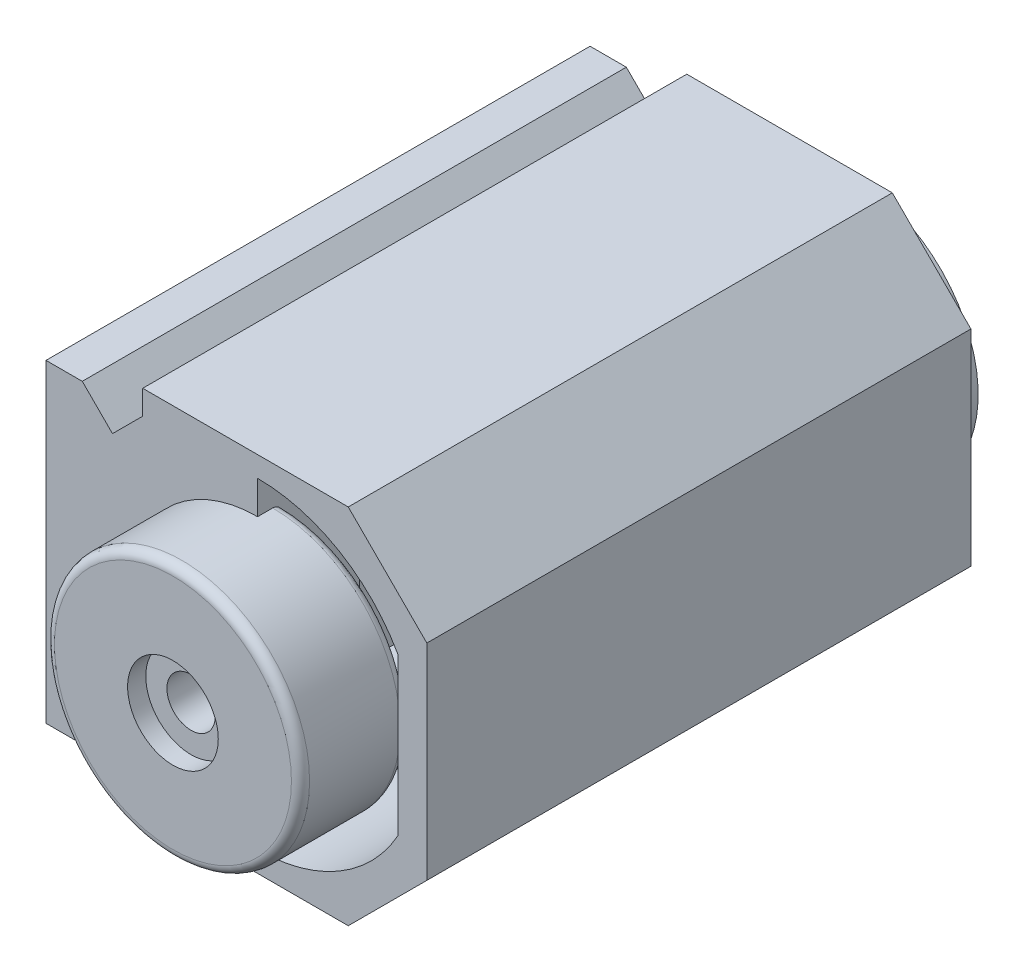
from build123d import *

# Parameters (mm, degrees)
BOSS_EXTRUDE1_DEPTH = 22.5
SKETCH2_R           = 10.5
SKETCH2_R_2         = 2
SKETCH2_R_3         = 0.5
BOSS_EXTRUDE2_DEPTH = 4.1
BOSS_EXTRUDE3_START = 7
SKETCH4_R           = 10.55
SKETCH4_R_2         = 2
BOSS_EXTRUDE3_DEPTH = 7
SKETCH5_R           = 3.75
CUT_EXTRUDE1_DEPTH  = 1.5
CUT_EXTRUDE2_DEPTH  = 15
SKETCH8_W           = 33
SKETCH8_H           = 13
CUT_EXTRUDE4_DEPTH  = 11.75
SKETCH9_W           = 22.9
SKETCH9_H           = 13
CUT_EXTRUDE5_DEPTH  = 17
SKETCH10_R          = 0.75
CUT_EXTRUDE6_DEPTH  = 8
SKETCH11_R          = 0.9
CUT_EXTRUDE7_DEPTH  = 10.75
CUT_EXTRUDE8_DEPTH  = 13
FILLET2_R           = 0.75
SKETCH14_W          = 13.5
SKETCH14_H          = 13
CUT_EXTRUDE9_DEPTH  = 7
FILLET3_R           = 6
SKETCH15_W          = 2
SKETCH15_H          = 20.442632008
CUT_EXTRUDE10_DEPTH = 54.926431367
SKETCH16_W          = 2.396552237
SKETCH16_H          = 13
BOSS_EXTRUDE5_DEPTH = 15
CHAMFER1_SIZE       = 0.35
CHAMFER1_SIZE_2     = 1
SKETCH17_W          = 0.25
SKETCH17_H          = 13
CUT_EXTRUDE11_DEPTH = 11.75


with BuildPart() as part:
    # Sketch1 → Boss-Extrude1 (new, symmetric)
    with BuildSketch(Plane.XY):
        Polygon((8.5, 15), (16, 7.5), (16, -7.5), (8.5, -15), (-8.5, -15), (-8.5, -13), (-11, -10.5), (-13.5, -13), (-16.5, -13), (-16.5, 13), (-13.5, 13), (-11, 10.5), (-8.5, 13), (-8.5, 15), align=None)
    extrude(amount=BOSS_EXTRUDE1_DEPTH, both=True)

    # Sketch2 → Boss-Extrude2 (add)
    with BuildSketch(Plane(origin=(0, 0, -22.5), x_dir=(-1, 0, 0), z_dir=(0, 0, -1))):
        with Locations((-1, 0)):
            Circle(SKETCH2_R)
        with Locations((-1, 0)):
            Circle(SKETCH2_R_2, mode=Mode.SUBTRACT)
        with Locations((-1, 6)):
            Circle(SKETCH2_R_3, mode=Mode.SUBTRACT)
        with Locations((-1, -6)):
            Circle(SKETCH2_R_3, mode=Mode.SUBTRACT)
    extrude(amount=BOSS_EXTRUDE2_DEPTH)

    # Sketch4 → Boss-Extrude3 (add)
    with BuildSketch(Plane.XY.offset(22.5).offset(BOSS_EXTRUDE3_START)):
        with Locations(Location((1, 0, 0), (0, 0, 180))):
            Circle(SKETCH4_R)
        with Locations(Location((1, 0, 0), (0, 0, 180))):
            Circle(SKETCH4_R_2, mode=Mode.SUBTRACT)
    extrude(amount=-BOSS_EXTRUDE3_DEPTH)

    # Sketch5 → Cut-Extrude1 (cut)
    with BuildSketch(Plane.XY.offset(29.5)):
        with Locations((1, 0)):
            Circle(SKETCH5_R)
    extrude(amount=-CUT_EXTRUDE1_DEPTH, mode=Mode.SUBTRACT)

    # Sketch6 → Cut-Extrude2 (cut)
    with BuildSketch(Plane.XY.offset(22.5)):
        with BuildLine():
            Line((1, 13.3), (1, 10.55))
            ThreePointArc((1, 10.55), (11.55, 0), (1, -10.55))
            Line((1, -10.55), (1, -13.3))
            ThreePointArc((1, -13.3), (14.3, 0), (1, 13.3))
        make_face()
    extrude(amount=-CUT_EXTRUDE2_DEPTH, mode=Mode.SUBTRACT)

    # Sketch8 → Cut-Extrude4 (cut)
    with BuildSketch(Plane.ZY.offset(16.5)):
        with Locations((-4.5, 0)):
            Rectangle(SKETCH8_W, SKETCH8_H)
    extrude(amount=-CUT_EXTRUDE4_DEPTH, mode=Mode.SUBTRACT)

    # Sketch9 → Cut-Extrude5 (cut)
    with BuildSketch(Plane.ZY.offset(4.75)):
        with Locations((-4.4, 0)):
            Rectangle(SKETCH9_W, SKETCH9_H)
    extrude(amount=-CUT_EXTRUDE5_DEPTH, mode=Mode.SUBTRACT)

    # Sketch10 → Cut-Extrude6 (cut)
    with BuildSketch(Plane.ZY.offset(16.5)):
        with Locations((0, 9)):
            Circle(SKETCH10_R)
        with Locations((0, -9)):
            Circle(SKETCH10_R)
    extrude(amount=-CUT_EXTRUDE6_DEPTH, mode=Mode.SUBTRACT)

    # Sketch11 → Cut-Extrude7 (cut)
    with BuildSketch(Plane.ZY.offset(4.75)):
        with Locations((-19.05, 0)):
            Circle(SKETCH11_R)
        with Locations((8.75, 0)):
            Circle(SKETCH11_R)
    extrude(amount=-CUT_EXTRUDE7_DEPTH, mode=Mode.SUBTRACT)

    # Sketch12 → Cut-Extrude8 (cut)
    with BuildSketch(Plane.XY.offset(20.5)):
        with BuildLine():
            Line((1, 13.3), (1, -13.3))
            ThreePointArc((1, -13.3), (14.3, 0), (1, 13.3))
        make_face()
    extrude(amount=-CUT_EXTRUDE8_DEPTH, mode=Mode.SUBTRACT)

    # Fillet2
    fillet2_edges = [part.edges().sort_by_distance(p)[0] for p in [
        (11.55, 0, 20.5),
        (11.55, 0, 29.5),
    ]]
    fillet(fillet2_edges, radius=FILLET2_R)

    # Sketch14 → Cut-Extrude9 (cut)
    with BuildSketch(Plane(origin=(0, 0, 7.05), x_dir=(-1, 0, 0), z_dir=(0, 0, -1))):
        with Locations((-5.5, 0)):
            Rectangle(SKETCH14_W, SKETCH14_H)
    extrude(amount=-CUT_EXTRUDE9_DEPTH, mode=Mode.SUBTRACT)

    # Fillet3
    # the kernel refuses this fillet: 6 mm, written as the material it takes off along each edge
    with BuildSketch(Plane(origin=(1, 6.5, 7.5), x_dir=(0, 0, -1), z_dir=(1, 0, 0))) as fillet3_piece_1_section:
        with BuildLine():
            CenterArc((FILLET3_R, FILLET3_R), FILLET3_R, 180, 90)
            Line((0, FILLET3_R), (0, 0))
            Line((0, 0), (FILLET3_R, 0))
        make_face()
    fillet3_piece_1 = extrude(amount=8.309783391, mode=Mode.PRIVATE)
    fillet3_piece_1 = fillet3_piece_1 & Plane(origin=(1, 0, 5.762056744), x_dir=(0, -1, 0), z_dir=(0, 0, 1)) * Cylinder(13.3, 41, mode=Mode.PRIVATE)
    add(fillet3_piece_1, mode=Mode.SUBTRACT)
    with BuildSketch(Plane(origin=(9.309783391, -6.5, 7.5), x_dir=(0, -1, 0), z_dir=(-1, 0, 0))) as fillet3_piece_2_section:
        with BuildLine():
            CenterArc((FILLET3_R, -FILLET3_R), FILLET3_R, 90, 90)
            Line((0, -FILLET3_R), (0, 0))
            Line((0, 0), (FILLET3_R, 0))
        make_face()
    fillet3_piece_2 = extrude(amount=8.309783391, mode=Mode.PRIVATE)
    fillet3_piece_2 = fillet3_piece_2 & Plane(origin=(1, 0, 7.288583483), x_dir=(0, -1, 0), z_dir=(0, 0, 1)) * Cylinder(13.3, 41, mode=Mode.PRIVATE)
    add(fillet3_piece_2, mode=Mode.SUBTRACT)
    with BuildSketch(Plane(origin=(12.25, -6.5, 7.5), x_dir=(0, 0, -1), z_dir=(-1, 0, 0))) as fillet3_piece_3_section:
        with BuildLine():
            CenterArc((FILLET3_R, FILLET3_R), FILLET3_R, 180, 90)
            Line((0, FILLET3_R), (0, 0))
            Line((0, 0), (FILLET3_R, 0))
        make_face()
    fillet3_piece_3 = extrude(amount=2.940216609, mode=Mode.PRIVATE)
    fillet3_piece_3 = fillet3_piece_3 & Plane(origin=(1, 0, 5.940678517), x_dir=(0, -1, 0), z_dir=(0, 0, 1)) * Cylinder(13.3, 30, mode=Mode.PRIVATE)
    add(fillet3_piece_3, mode=Mode.SUBTRACT)
    with BuildSketch(Plane(origin=(9.309783391, 6.5, 7.5), x_dir=(0, 0, -1), z_dir=(1, 0, 0))) as fillet3_piece_4_section:
        with BuildLine():
            CenterArc((FILLET3_R, FILLET3_R), FILLET3_R, 180, 90)
            Line((0, FILLET3_R), (0, 0))
            Line((0, 0), (FILLET3_R, 0))
        make_face()
    fillet3_piece_4 = extrude(amount=2.940216609, mode=Mode.PRIVATE)
    fillet3_piece_4 = fillet3_piece_4 & Plane(origin=(1, 0, 5.940678478), x_dir=(0, -1, 0), z_dir=(0, 0, 1)) * Cylinder(13.3, 30, mode=Mode.PRIVATE)
    add(fillet3_piece_4, mode=Mode.SUBTRACT)

    # Sketch15 → Cut-Extrude10 (cut, through all)
    with BuildSketch(Plane.XY.offset(22.5)):
        with Locations((16, 0)):
            Rectangle(SKETCH15_W, SKETCH15_H)
    extrude(amount=-CUT_EXTRUDE10_DEPTH, mode=Mode.SUBTRACT)

    # Sketch16 → Boss-Extrude5 (add)
    with BuildSketch(Plane.XY.offset(22.5)):
        with Locations((13.801723882, 0)):
            Rectangle(SKETCH16_W, SKETCH16_H)
    extrude(amount=-BOSS_EXTRUDE5_DEPTH)

    # Chamfer1
    # the kernel refuses this chamfer: 1, 0.35 mm, written as the material it takes off along each edge
    with BuildSketch(Plane(origin=(12.25, 6.5, 7.5), x_dir=(0.9946410899892074, 0, 0.10338811394488918), z_dir=(0, -1, 0))) as chamfer1_piece_1:
        Polygon((CHAMFER1_SIZE * 0.994641089989, -CHAMFER1_SIZE * 0.103388113945), (-CHAMFER1_SIZE_2 * 0.103388113945, -CHAMFER1_SIZE_2 * 0.994641089989), (0, 0), align=None)
    extrude(amount=13, mode=Mode.SUBTRACT)
    with BuildSketch(Plane(origin=(12.25, 9.688783911, 7.5), x_dir=(0.9946410899892074, 0, 0.10338811394488918), z_dir=(0, -1, 0))) as chamfer1_piece_2_section:
        Polygon((CHAMFER1_SIZE * 0.994641089989, -CHAMFER1_SIZE * 0.103388113945), (-CHAMFER1_SIZE_2 * 0.103388113945, -CHAMFER1_SIZE_2 * 0.994641089989), (0, 0), align=None)
    chamfer1_piece_2 = extrude(amount=3.188783911, mode=Mode.PRIVATE)
    chamfer1_piece_2 = chamfer1_piece_2 & Plane(origin=(1, 0, 7.126715107), x_dir=(0, -1, 0), z_dir=(0, 0, 1)) * Cylinder(13.3, 11, mode=Mode.PRIVATE)
    add(chamfer1_piece_2, mode=Mode.SUBTRACT)
    with BuildSketch(Plane(origin=(12.25, -9.688783911, 7.5), x_dir=(0.9946410899892074, 0, 0.10338811394488918), z_dir=(0, 1, 0))) as chamfer1_piece_3_section:
        Polygon((CHAMFER1_SIZE * 0.994641089989, CHAMFER1_SIZE * 0.103388113945), (-CHAMFER1_SIZE_2 * 0.103388113945, CHAMFER1_SIZE_2 * 0.994641089989), (0, 0), align=None)
    chamfer1_piece_3 = extrude(amount=3.188783911, mode=Mode.PRIVATE)
    chamfer1_piece_3 = chamfer1_piece_3 & Plane(origin=(1, 0, 7.126715107), x_dir=(0, -1, 0), z_dir=(0, 0, 1)) * Cylinder(13.3, 11, mode=Mode.PRIVATE)
    add(chamfer1_piece_3, mode=Mode.SUBTRACT)

    # Sketch17 → Cut-Extrude11 (cut)
    with BuildSketch(Plane.ZY.offset(16.5)):
        with Locations((-21.125, 0)):
            Rectangle(SKETCH17_W, SKETCH17_H)
    extrude(amount=-CUT_EXTRUDE11_DEPTH, mode=Mode.SUBTRACT)


solid = part.part
